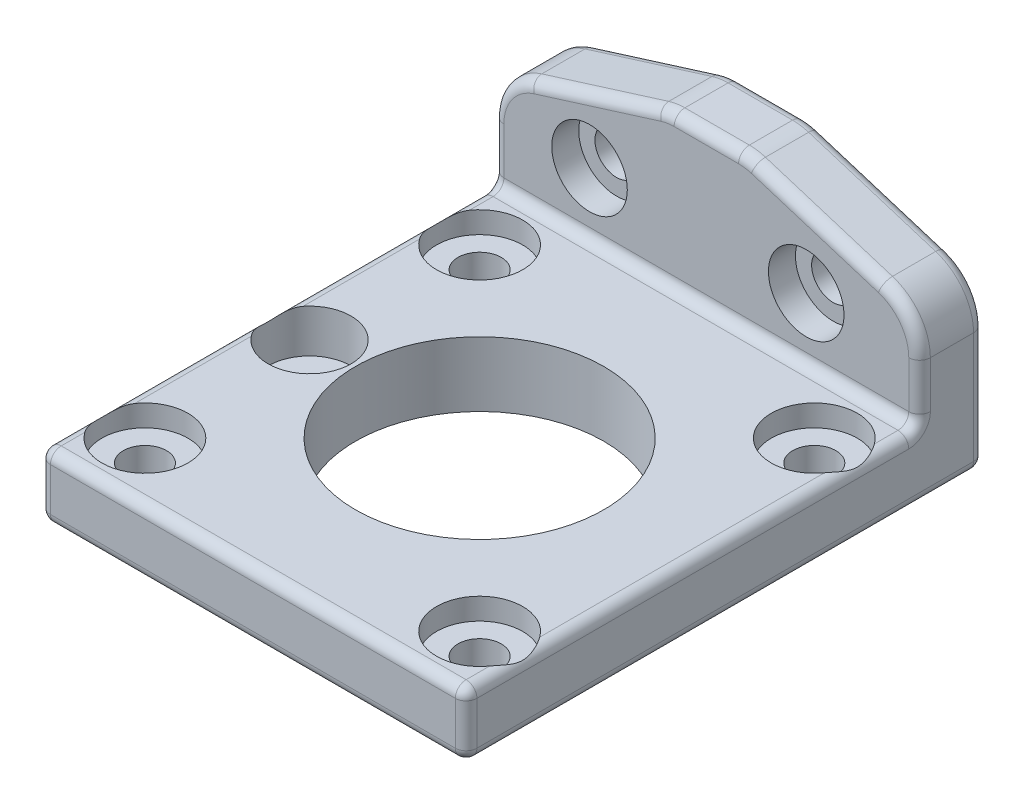
from build123d import *

# Parameters (mm, degrees)
SKETCH1_W           = 39.5
SKETCH1_H           = 42
BOSS_EXTRUDE1_DEPTH = 6
SKETCH3_R           = 3.9905
CUT_EXTRUDE1_DEPTH  = 2
SKETCH4_R           = 11.5
SKETCH4_R_2         = 2
CUT_EXTRUDE2_DEPTH  = 30.445925015
BOSS_EXTRUDE2_DEPTH = 6
SKETCH6_R           = 3.5
CUT_EXTRUDE3_DEPTH  = 2.5
SKETCH7_R           = 2
CUT_EXTRUDE4_DEPTH  = 51.537733428
FILLET1_R           = 5
SKETCH8_R           = 3.84125
CUT_EXTRUDE5_DEPTH  = 4
FILLET2_R           = 1


with BuildPart() as part:
    # Sketch1 → Boss-Extrude1 (new body)
    with BuildSketch(Plane(origin=(0, 0, 0), x_dir=(1, 0, 0), z_dir=(0, 1, 0))):
        Rectangle(SKETCH1_W, SKETCH1_H)
    extrude(amount=BOSS_EXTRUDE1_DEPTH)

    # Sketch3 → Cut-Extrude1 (cut)
    with BuildSketch(Plane(origin=(0, 6, 0), x_dir=(1, 0, 0), z_dir=(0, 1, 0))):
        with Locations(Location((-15.5, 15.5, 0), (0, 0, 270))):
            Circle(SKETCH3_R)
        with Locations(Location((15.5, 15.5, 0), (0, 0, 270))):
            Circle(SKETCH3_R)
        with Locations(Location((-15.5, -15.5, 0), (0, 0, 270))):
            Circle(SKETCH3_R)
        with Locations(Location((15.5, -15.5, 0), (0, 0, 270))):
            Circle(SKETCH3_R)
    extrude(amount=-CUT_EXTRUDE1_DEPTH, mode=Mode.SUBTRACT)

    # Sketch4 → Cut-Extrude2 (cut, through all)
    with BuildSketch(Plane(origin=(0, 6, 0), x_dir=(1, 0, 0), z_dir=(0, 1, 0))):
        with Locations(Location((0, 0, 0), (0, 0, 270))):
            Circle(SKETCH4_R)
        with Locations(Location((15.5, 15.5, 0), (0, 0, 270))):
            Circle(SKETCH4_R_2)
        with Locations(Location((-15.5, 15.5, 0), (0, 0, 270))):
            Circle(SKETCH4_R_2)
        with Locations(Location((-15.5, -15.5, 0), (0, 0, 270))):
            Circle(SKETCH4_R_2)
        with Locations(Location((15.5, -15.5, 0), (0, 0, 270))):
            Circle(SKETCH4_R_2)
    extrude(amount=-CUT_EXTRUDE2_DEPTH, mode=Mode.SUBTRACT)

    # Sketch5 → Boss-Extrude2 (add)
    with BuildSketch(Plane(origin=(0, 0, -21), x_dir=(-1, 0, 0), z_dir=(0, 0, -1))):
        Polygon((-19.75, 15), (-19.75, 0), (19.75, 0), (19.75, 15), (3.75, 20), (-3.75, 20), align=None)
    extrude(amount=BOSS_EXTRUDE2_DEPTH)

    # Sketch6 → Cut-Extrude3 (cut)
    with BuildSketch(Plane.XY.offset(-21)):
        with Locations((-10.82, 11.75)):
            Circle(SKETCH6_R)
        with Locations((9.25, 11.75)):
            Circle(SKETCH6_R)
    extrude(amount=-CUT_EXTRUDE3_DEPTH, mode=Mode.SUBTRACT)

    # Sketch7 → Cut-Extrude4 (cut, through all)
    with BuildSketch(Plane.XY.offset(-21)):
        with Locations((-10.82, 11.75)):
            Circle(SKETCH7_R)
        with Locations((9.25, 11.75)):
            Circle(SKETCH7_R)
    extrude(amount=-CUT_EXTRUDE4_DEPTH, mode=Mode.SUBTRACT)

    # Fillet1
    fillet1_edges = [part.edges().sort_by_distance(p)[0] for p in [
        (-19.75, 15, -24),
        (-3.75, 20, -24),
        (3.75, 20, -24),
        (19.75, 15, -24),
    ]]
    fillet(fillet1_edges, radius=FILLET1_R)

    # Sketch8 → Cut-Extrude5 (cut)
    with BuildSketch(Plane(origin=(0, 6, 0), x_dir=(1, 0, 0), z_dir=(0, 1, 0))):
        with Locations(Location((-15.75, 0, 0), (0, 0, 270))):
            Circle(SKETCH8_R)
    extrude(amount=-CUT_EXTRUDE5_DEPTH, mode=Mode.SUBTRACT)

    # Fillet2
    # the kernel refuses this fillet: 1 mm, written as the material it adds along each edge
    with BuildSketch(Plane(origin=(-19.75, 6, -21), x_dir=(0, 1, 0), z_dir=(1, 0, 0))) as fillet2_piece_1:
        with BuildLine():
            CenterArc((FILLET2_R, FILLET2_R), FILLET2_R, 180, 90)
            Line((0, FILLET2_R), (0, 0))
            Line((0, 0), (FILLET2_R, 0))
        make_face()
    extrude(amount=39.5)
    # the kernel refuses this fillet: 1 mm, written as the material it takes off along each edge
    with BuildSketch(Plane(origin=(18.75, 1, 20), x_dir=(0, 0, 1), z_dir=(1, 0, 0))) as fillet2_2_piece_1_section:
        Polygon((0, 0), (FILLET2_R, 0), (FILLET2_R, FILLET2_R), (0, FILLET2_R), align=None)
    fillet2_2_piece_1 = extrude(amount=FILLET2_R, mode=Mode.PRIVATE)
    fillet2_2_piece_1 = fillet2_2_piece_1 - Plane(origin=(18.75, 1, 20), x_dir=(0, 0.7071067811865475, -0.7071067811865475), z_dir=(1, 0, 0)) * Sphere(FILLET2_R, mode=Mode.PRIVATE)
    add(fillet2_2_piece_1, mode=Mode.SUBTRACT)
    with BuildSketch(Plane(origin=(-18.75, 1, 20), x_dir=(0, 0, 1), z_dir=(-1, 0, 0))) as fillet2_2_piece_2_section:
        Polygon((0, 0), (FILLET2_R, 0), (FILLET2_R, -FILLET2_R), (0, -FILLET2_R), align=None)
    fillet2_2_piece_2 = extrude(amount=FILLET2_R, mode=Mode.PRIVATE)
    fillet2_2_piece_2 = fillet2_2_piece_2 - Plane(origin=(-18.75, 1, 20), x_dir=(0, 0.7071067811865475, -0.7071067811865475), z_dir=(-1, 0, 0)) * Sphere(FILLET2_R, mode=Mode.PRIVATE)
    add(fillet2_2_piece_2, mode=Mode.SUBTRACT)
    with BuildSketch(Plane(origin=(-18.75, 1, -26), x_dir=(0, 0, -1), z_dir=(-1, 0, 0))) as fillet2_2_piece_3_section:
        Polygon((0, 0), (FILLET2_R, 0), (FILLET2_R, FILLET2_R), (0, FILLET2_R), align=None)
    fillet2_2_piece_3 = extrude(amount=FILLET2_R, mode=Mode.PRIVATE)
    fillet2_2_piece_3 = fillet2_2_piece_3 - Plane(origin=(-18.75, 1, -26), x_dir=(0, 0.7071067811865475, 0.7071067811865475), z_dir=(-1, 0, 0)) * Sphere(FILLET2_R, mode=Mode.PRIVATE)
    add(fillet2_2_piece_3, mode=Mode.SUBTRACT)
    with BuildSketch(Plane(origin=(18.75, 1, -26), x_dir=(0, 0, -1), z_dir=(1, 0, 0))) as fillet2_2_piece_4_section:
        Polygon((0, 0), (FILLET2_R, 0), (FILLET2_R, -FILLET2_R), (0, -FILLET2_R), align=None)
    fillet2_2_piece_4 = extrude(amount=FILLET2_R, mode=Mode.PRIVATE)
    fillet2_2_piece_4 = fillet2_2_piece_4 - Plane(origin=(18.75, 1, -26), x_dir=(0, 0.7071067811865475, 0.7071067811865475), z_dir=(1, 0, 0)) * Sphere(FILLET2_R, mode=Mode.PRIVATE)
    add(fillet2_2_piece_4, mode=Mode.SUBTRACT)
    with BuildSketch(Plane(origin=(-2.986945386, 15, -27), x_dir=(-0.2982749931359473, 0.9544799780350296, 0), z_dir=(-0.9544799780350296, -0.2982749931359473, 0))) as fillet2_2_piece_5:
        with BuildLine():
            CenterArc((5 - FILLET2_R, -FILLET2_R), FILLET2_R, 0, 90)
            Line((5, -FILLET2_R), (5, 0))
            Line((5, 0), (5 - FILLET2_R, 0))
        make_face()
    revolve(axis=Axis((-2.986945386, 15, -27), (0, 0, -1)), revolution_arc=17.354024636, mode=Mode.SUBTRACT)
    with BuildSketch(Plane(origin=(2.986945386, 15, -27), x_dir=(0.2982749931359473, 0.9544799780350296, 0), z_dir=(0.9544799780350296, -0.2982749931359473, 0))) as fillet2_2_piece_6:
        with BuildLine():
            CenterArc((5 - FILLET2_R, FILLET2_R), FILLET2_R, 270, 90)
            Line((5, FILLET2_R), (5, 0))
            Line((5, 0), (5 - FILLET2_R, 0))
        make_face()
    revolve(axis=Axis((2.986945386, 15, -27), (0, 0, 1)), revolution_arc=17.354024636, mode=Mode.SUBTRACT)
    with BuildSketch(Plane(origin=(14.75, 11.324045433, -27), x_dir=(1, 0, 0), z_dir=(0, -1, 0))) as fillet2_2_piece_7:
        with BuildLine():
            CenterArc((5 - FILLET2_R, FILLET2_R), FILLET2_R, 270, 90)
            Line((5, FILLET2_R), (5, 0))
            Line((5, 0), (5 - FILLET2_R, 0))
        make_face()
    revolve(axis=Axis((14.75, 11.324045433, -27), (0, 0, 1)), revolution_arc=72.645975364, mode=Mode.SUBTRACT)
    with BuildSketch(Plane(origin=(22.25, 6, 21), x_dir=(0, 0, -1), z_dir=(-1, 0, 0))) as fillet2_2_piece_8:
        with BuildLine():
            CenterArc((FILLET2_R, FILLET2_R), FILLET2_R, 180, 90)
            Line((0, FILLET2_R), (0, 0))
            Line((0, 0), (FILLET2_R, 0))
        make_face()
    extrude(amount=44.5, mode=Mode.SUBTRACT)
    with BuildSketch(Plane(origin=(18.75, 0, 21), x_dir=(0, 1, 0), z_dir=(-1, 0, 0))) as fillet2_2_piece_9:
        with BuildLine():
            CenterArc((FILLET2_R, FILLET2_R), FILLET2_R, 180, 90)
            Line((0, FILLET2_R), (0, 0))
            Line((0, 0), (FILLET2_R, 0))
        make_face()
    extrude(amount=37.5, mode=Mode.SUBTRACT)
    with BuildSketch(Plane(origin=(-19.75, 0, -26), x_dir=(0, 1, 0), z_dir=(0, 0, 1)), Plane(origin=(19.75, 0, -26), x_dir=(-1, 0, 0), z_dir=(0, 0, 1))) as fillet2_2_piece_10:
        with BuildLine():
            CenterArc((FILLET2_R, -FILLET2_R), FILLET2_R, 90, 90)
            Line((0, -FILLET2_R), (0, 0))
            Line((0, 0), (FILLET2_R, 0))
        make_face()
    extrude(amount=46, mode=Mode.SUBTRACT)
    with BuildSketch(Plane(origin=(-19.75, 1, -27), x_dir=(0, 0, 1), z_dir=(0, 1, 0))) as fillet2_2_piece_11:
        with BuildLine():
            CenterArc((FILLET2_R, FILLET2_R), FILLET2_R, 180, 90)
            Line((0, FILLET2_R), (0, 0))
            Line((0, 0), (FILLET2_R, 0))
        make_face()
    extrude(amount=10.324045433, mode=Mode.SUBTRACT)
    with BuildSketch(Plane(origin=(18.75, 0, -27), x_dir=(0, 1, 0), z_dir=(-1, 0, 0))) as fillet2_2_piece_12:
        with BuildLine():
            CenterArc((FILLET2_R, -FILLET2_R), FILLET2_R, 90, 90)
            Line((0, -FILLET2_R), (0, 0))
            Line((0, 0), (FILLET2_R, 0))
        make_face()
    extrude(amount=37.5, mode=Mode.SUBTRACT)
    with BuildSketch(Plane(origin=(19.75, 1, 21), x_dir=(-1, 0, 0), z_dir=(0, 1, 0)), Plane(origin=(-19.75, 1, 21), x_dir=(0, 0, -1), z_dir=(0, 1, 0))) as fillet2_2_piece_13:
        with BuildLine():
            CenterArc((FILLET2_R, -FILLET2_R), FILLET2_R, 90, 90)
            Line((0, -FILLET2_R), (0, 0))
            Line((0, 0), (FILLET2_R, 0))
        make_face()
    extrude(amount=7.5, mode=Mode.SUBTRACT)
    with BuildSketch(Plane(origin=(19.75, 11.324045433, -27), x_dir=(-1, 0, 0), z_dir=(0, -1, 0))) as fillet2_2_piece_14:
        with BuildLine():
            CenterArc((FILLET2_R, -FILLET2_R), FILLET2_R, 90, 90)
            Line((0, -FILLET2_R), (0, 0))
            Line((0, 0), (FILLET2_R, 0))
        make_face()
    extrude(amount=10.324045433, mode=Mode.SUBTRACT)
    with BuildSketch(Plane(origin=(4.478320351, 19.77239989, -27), x_dir=(-0.2982749931359471, -0.9544799780350297, 0), z_dir=(0.9544799780350297, -0.2982749931359471, 0)), Plane(origin=(-16.241374966, 16.096445323, -27), x_dir=(0.2982749931359466, -0.9544799780350298, 0), z_dir=(0.9544799780350299, 0.29827499313594663, 0))) as fillet2_2_piece_15:
        with BuildLine():
            CenterArc((FILLET2_R, -FILLET2_R), FILLET2_R, 90, 90)
            Line((0, -FILLET2_R), (0, 0))
            Line((0, 0), (FILLET2_R, 0))
        make_face()
    extrude(amount=12.324045433, mode=Mode.SUBTRACT)
    with BuildSketch(Plane(origin=(-2.986945386, 20, -27), x_dir=(0, -1, 0), z_dir=(1, 0, 0))) as fillet2_2_piece_16:
        with BuildLine():
            CenterArc((FILLET2_R, -FILLET2_R), FILLET2_R, 90, 90)
            Line((0, -FILLET2_R), (0, 0))
            Line((0, 0), (FILLET2_R, 0))
        make_face()
    extrude(amount=5.973890772, mode=Mode.SUBTRACT)
    with BuildSketch(Plane(origin=(-14.75, 11.324045433, -27), x_dir=(-1, 0, 0), z_dir=(0, -1, 0))) as fillet2_2_piece_17:
        with BuildLine():
            CenterArc((5 - FILLET2_R, -FILLET2_R), FILLET2_R, 0, 90)
            Line((5 - FILLET2_R, 0), (5, 0))
            Line((5, 0), (5, -FILLET2_R))
        make_face()
    revolve(axis=Axis((-14.75, 11.324045433, -27), (0, 0, -1)), revolution_arc=72.645975364, mode=Mode.SUBTRACT)
    # the kernel refuses this fillet: 1 mm, written as the material it takes off along each edge
    with BuildSketch(Plane(origin=(18.75, 5, 20), x_dir=(1, 0, 0), z_dir=(0, 1, 0))) as fillet2_3_piece_1_section:
        Polygon((0, 0), (FILLET2_R, 0), (FILLET2_R, -FILLET2_R), (0, -FILLET2_R), align=None)
    fillet2_3_piece_1 = extrude(amount=FILLET2_R, mode=Mode.PRIVATE)
    fillet2_3_piece_1 = fillet2_3_piece_1 - Plane(origin=(18.75, 5, 20), x_dir=(-0.7071067811865476, 0, -0.7071067811865475), z_dir=(0, 1, 0)) * Sphere(FILLET2_R, mode=Mode.PRIVATE)
    add(fillet2_3_piece_1, mode=Mode.SUBTRACT)
    with BuildSketch(Plane(origin=(-18.75, 5, 20), x_dir=(0, 1, 0), z_dir=(-1, 0, 0))) as fillet2_3_piece_2_section:
        Polygon((0, 0), (FILLET2_R, 0), (FILLET2_R, -FILLET2_R), (0, -FILLET2_R), align=None)
    fillet2_3_piece_2 = extrude(amount=FILLET2_R, mode=Mode.PRIVATE)
    fillet2_3_piece_2 = fillet2_3_piece_2 - Plane(origin=(-18.75, 5, 20), x_dir=(0, -0.7071067811865475, -0.7071067811865475), z_dir=(-1, 0, 0)) * Sphere(FILLET2_R, mode=Mode.PRIVATE)
    add(fillet2_3_piece_2, mode=Mode.SUBTRACT)
    with BuildSketch(Plane(origin=(-19.75, 6, 20), x_dir=(0, -1, 0), z_dir=(0, 0, -1))) as fillet2_3_piece_3:
        with BuildLine():
            CenterArc((FILLET2_R, -FILLET2_R), FILLET2_R, 90, 90)
            Line((0, -FILLET2_R), (0, 0))
            Line((0, 0), (FILLET2_R, 0))
        make_face()
    extrude(amount=40, mode=Mode.SUBTRACT)
    with BuildSketch(Plane(origin=(19.75, 6, -20), x_dir=(-1, 0, 0), z_dir=(0, 0, 1))) as fillet2_3_piece_4:
        with BuildLine():
            CenterArc((FILLET2_R, FILLET2_R), FILLET2_R, 180, 90)
            Line((0, FILLET2_R), (0, 0))
            Line((0, 0), (FILLET2_R, 0))
        make_face()
    extrude(amount=40, mode=Mode.SUBTRACT)
    with BuildSketch(Plane(origin=(-19.75, 7, -21), x_dir=(0, 0, -1), z_dir=(0, 1, 0))) as fillet2_3_piece_5:
        with BuildLine():
            CenterArc((FILLET2_R, -FILLET2_R), FILLET2_R, 90, 90)
            Line((0, -FILLET2_R), (0, 0))
            Line((0, 0), (FILLET2_R, 0))
        make_face()
    extrude(amount=4.324045433, mode=Mode.SUBTRACT)
    with BuildSketch(Plane(origin=(19.75, 11.324045433, -21), x_dir=(-1, 0, 0), z_dir=(0, -1, 0))) as fillet2_3_piece_6:
        with BuildLine():
            CenterArc((FILLET2_R, FILLET2_R), FILLET2_R, 180, 90)
            Line((0, FILLET2_R), (0, 0))
            Line((0, 0), (FILLET2_R, 0))
        make_face()
    extrude(amount=4.324045433, mode=Mode.SUBTRACT)
    with BuildSketch(Plane(origin=(4.478320351, 19.77239989, -21), x_dir=(-0.2982749931359471, -0.9544799780350297, 0), z_dir=(0.9544799780350297, -0.2982749931359471, 0)), Plane(origin=(-16.241374966, 16.096445323, -21), x_dir=(0.2982749931359466, -0.9544799780350298, 0), z_dir=(0.9544799780350299, 0.29827499313594663, 0))) as fillet2_3_piece_7:
        with BuildLine():
            CenterArc((FILLET2_R, FILLET2_R), FILLET2_R, 180, 90)
            Line((0, FILLET2_R), (0, 0))
            Line((0, 0), (FILLET2_R, 0))
        make_face()
    extrude(amount=12.324045433, mode=Mode.SUBTRACT)
    with BuildSketch(Plane(origin=(-2.986945386, 20, -21), x_dir=(0, -1, 0), z_dir=(1, 0, 0))) as fillet2_3_piece_8:
        with BuildLine():
            CenterArc((FILLET2_R, FILLET2_R), FILLET2_R, 180, 90)
            Line((0, FILLET2_R), (0, 0))
            Line((0, 0), (FILLET2_R, 0))
        make_face()
    extrude(amount=5.973890772, mode=Mode.SUBTRACT)
    with BuildSketch(Plane(origin=(-14.75, 11.324045433, -21), x_dir=(-1, 0, 0), z_dir=(0, -1, 0))) as fillet2_3_piece_9:
        with BuildLine():
            CenterArc((5 - FILLET2_R, FILLET2_R), FILLET2_R, 270, 90)
            Line((5 - FILLET2_R, 0), (5, 0))
            Line((5, 0), (5, FILLET2_R))
        make_face()
    revolve(axis=Axis((-14.75, 11.324045433, -21), (0, 0, -1)), revolution_arc=72.645975364, mode=Mode.SUBTRACT)
    with BuildSketch(Plane(origin=(-2.986945386, 15, -21), x_dir=(-0.2982749931359473, 0.9544799780350296, 0), z_dir=(-0.9544799780350296, -0.2982749931359473, 0))) as fillet2_3_piece_10:
        with BuildLine():
            CenterArc((5 - FILLET2_R, FILLET2_R), FILLET2_R, 270, 90)
            Line((5, FILLET2_R), (5, 0))
            Line((5, 0), (5 - FILLET2_R, 0))
        make_face()
    revolve(axis=Axis((-2.986945386, 15, -21), (0, 0, -1)), revolution_arc=17.354024636, mode=Mode.SUBTRACT)
    with BuildSketch(Plane(origin=(2.986945386, 15, -21), x_dir=(0.2982749931359473, 0.9544799780350296, 0), z_dir=(0.9544799780350296, -0.2982749931359473, 0))) as fillet2_3_piece_11:
        with BuildLine():
            CenterArc((5 - FILLET2_R, -FILLET2_R), FILLET2_R, 0, 90)
            Line((5, -FILLET2_R), (5, 0))
            Line((5, 0), (5 - FILLET2_R, 0))
        make_face()
    revolve(axis=Axis((2.986945386, 15, -21), (0, 0, 1)), revolution_arc=17.354024636, mode=Mode.SUBTRACT)
    with BuildSketch(Plane(origin=(14.75, 11.324045433, -21), x_dir=(1, 0, 0), z_dir=(0, -1, 0))) as fillet2_3_piece_12:
        with BuildLine():
            CenterArc((5 - FILLET2_R, -FILLET2_R), FILLET2_R, 0, 90)
            Line((5, -FILLET2_R), (5, 0))
            Line((5, 0), (5 - FILLET2_R, 0))
        make_face()
    revolve(axis=Axis((14.75, 11.324045433, -21), (0, 0, 1)), revolution_arc=72.645975364, mode=Mode.SUBTRACT)
    with BuildSketch(Plane(origin=(19.75, 7, -20), x_dir=(0, 0, -1), z_dir=(0, 1, 0))) as fillet2_3_piece_13:
        with BuildLine():
            CenterArc((1 + FILLET2_R, FILLET2_R), FILLET2_R, 180, 90)
            Line((1 + FILLET2_R, 0), (1, 0))
            Line((1, 0), (1, FILLET2_R))
        make_face()
    revolve(axis=Axis((19.75, 7, -20), (-1, 0, 0)), revolution_arc=90, mode=Mode.SUBTRACT)
    with BuildSketch(Plane(origin=(-19.75, 7, -20), x_dir=(0, 0, -1), z_dir=(0, 1, 0))) as fillet2_3_piece_14:
        with BuildLine():
            CenterArc((1 + FILLET2_R, -FILLET2_R), FILLET2_R, 90, 90)
            Line((1, -FILLET2_R), (1, 0))
            Line((1, 0), (1 + FILLET2_R, 0))
        make_face()
    revolve(axis=Axis((-19.75, 7, -20), (-1, 0, 0)), revolution_arc=90, mode=Mode.SUBTRACT)


solid = part.part
